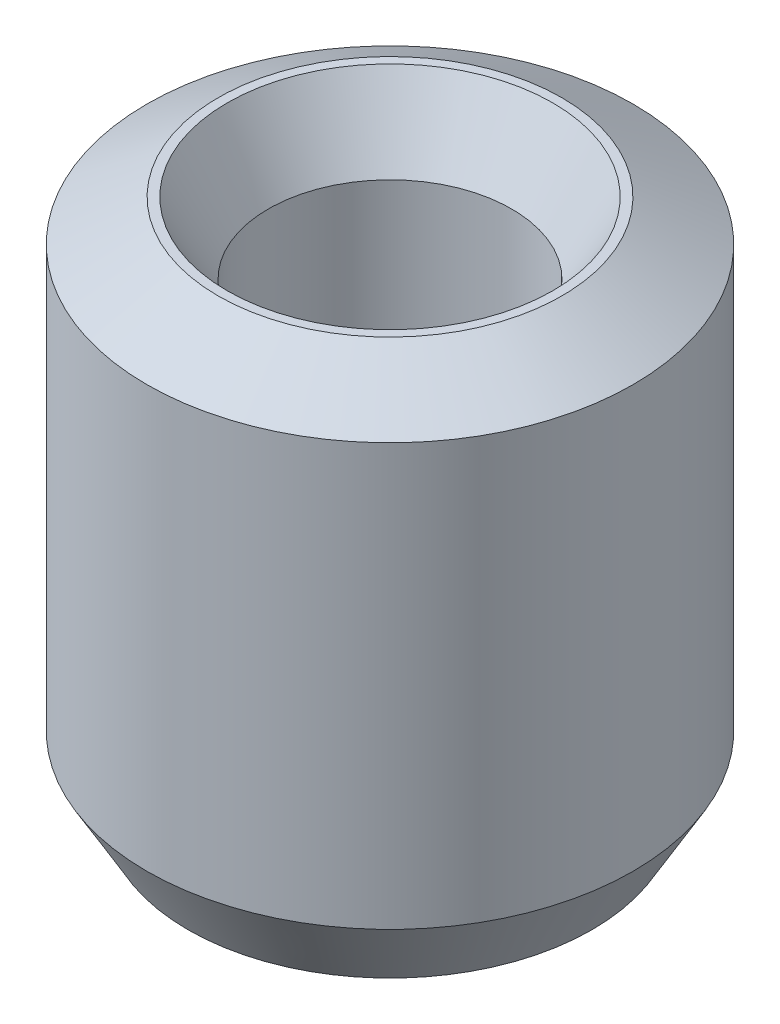
from build123d import *
from OCP.BRepFilletAPI import BRepFilletAPI_MakeChamfer

# Parameters (mm, degrees)
SKETCH1_R           = 22.5
BOSS_EXTRUDE1_DEPTH = 49.418608105
SKETCH2_R           = 11.259846957
CUT_EXTRUDE1_DEPTH  = 59.776686084
CHAMFER1_SIZE       = 3.808836917
CHAMFER1_SIZE2      = 6.597099057


with BuildPart() as part:
    # Sketch1 → Boss-Extrude1 (new body)
    with BuildSketch(Plane(origin=(0, 0, 0), x_dir=(1, 0, 0), z_dir=(0, 1, 0))):
        Circle(SKETCH1_R)
    extrude(amount=BOSS_EXTRUDE1_DEPTH)

    # Sketch2 → Cut-Extrude1 (cut, through all)
    with BuildSketch(Plane(origin=(0, 0, 0), x_dir=(1, 0, 0), z_dir=(0, 1, 0))):
        Circle(SKETCH2_R)
    extrude(amount=CUT_EXTRUDE1_DEPTH, mode=Mode.SUBTRACT)

    # Chamfer1: one chamfer whose edges measure the first distance from different faces: ONE call of the kernel's chamfer builder (chamfer() names one face for all edges)
    chamfer1_edges_1 = [part.edges().sort_by_distance(p)[0] for p in [
        (-11.259846957, 49.418608105, 0),
    ]]
    chamfer1_side_1 = [part.faces().sort_by_distance(p)[0] for p in [
        (-21.863603897, 49.418608105, 0),
    ]]
    chamfer1_edges_2 = [part.edges().sort_by_distance(p)[0] for p in [
        (-11.259846957, 0, 0),
    ]]
    chamfer1_side_2 = [part.faces().sort_by_distance(p)[0] for p in [
        (-11.259846957, 24.709304053, 0),
    ]]
    chamfer1_edges_3 = [part.edges().sort_by_distance(p)[0] for p in [
        (-22.5, 0, 0),
    ]]
    chamfer1_side_3 = [part.faces().sort_by_distance(p)[0] for p in [
        (-21.863603897, 0, 0),
    ]]
    chamfer1_edges_4 = [part.edges().sort_by_distance(p)[0] for p in [
        (-22.5, 49.418608105, 0),
    ]]
    chamfer1_side_4 = [part.faces().sort_by_distance(p)[0] for p in [
        (-22.5, 24.709304053, 0),
    ]]
    chamfer1 = BRepFilletAPI_MakeChamfer(part.part.solid().wrapped)
    for e in chamfer1_edges_1:
        chamfer1.Add(CHAMFER1_SIZE, CHAMFER1_SIZE2, e.wrapped, chamfer1_side_1[0].wrapped)  # the first distance lies on this face
    for e in chamfer1_edges_2:
        chamfer1.Add(CHAMFER1_SIZE, CHAMFER1_SIZE2, e.wrapped, chamfer1_side_2[0].wrapped)  # the first distance lies on this face
    for e in chamfer1_edges_3:
        chamfer1.Add(CHAMFER1_SIZE, CHAMFER1_SIZE2, e.wrapped, chamfer1_side_3[0].wrapped)  # the first distance lies on this face
    for e in chamfer1_edges_4:
        chamfer1.Add(CHAMFER1_SIZE, CHAMFER1_SIZE2, e.wrapped, chamfer1_side_4[0].wrapped)  # the first distance lies on this face
    add(Compound.cast(chamfer1.Shape()), mode=Mode.REPLACE)


solid = part.part
